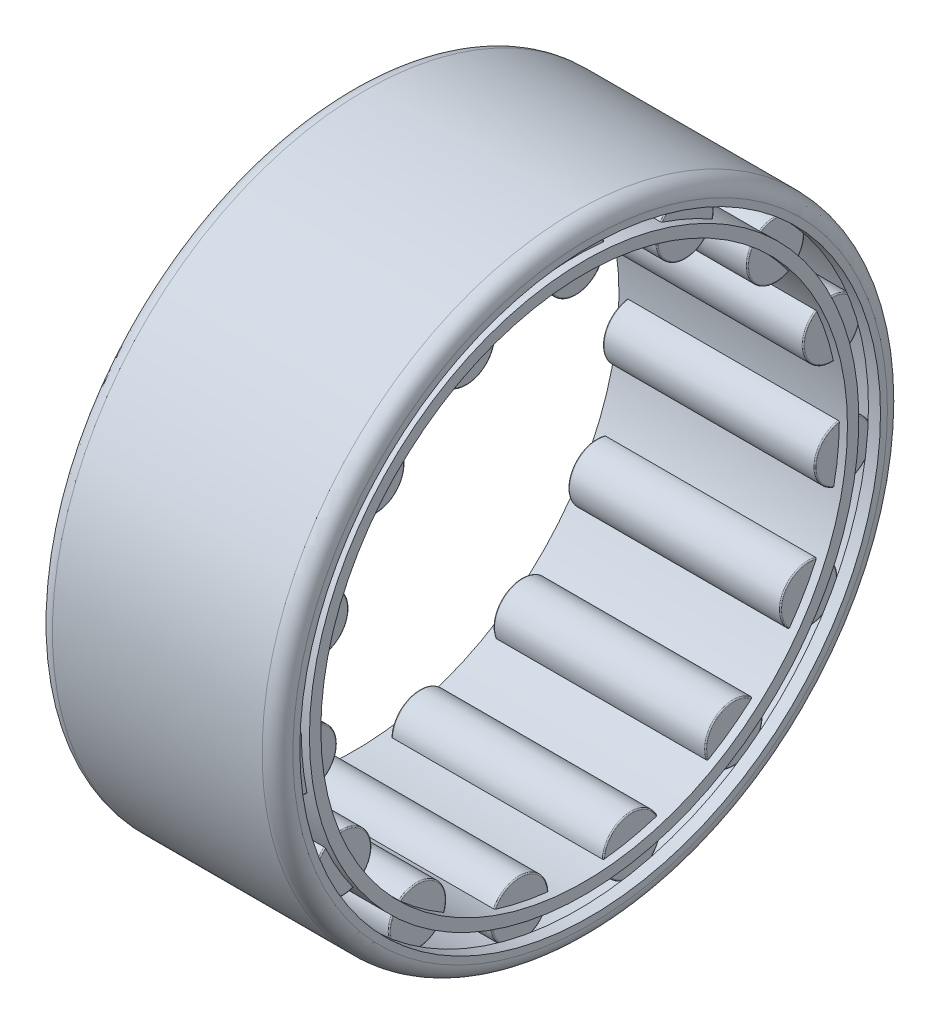
from build123d import *

# Parameters (mm, degrees)
CAGSPISKE_W           = 30.1625
CAGSPISKE_H           = 1.50642
ROLLERSDETAILED_COUNT = 15
ROLLERSDETAILED_ANGLE = 336


with BuildPart() as part:
    # InnRacSke → Race (revolve)
    with BuildSketch(Plane.XY):
        with BuildLine():
            Line((-14.2875, 38.3286), (-15.875, 38.3286))
            Line((-15.875, 38.3286), (-15.875, 39.243))
            ThreePointArc((-15.875, 39.243), (-15.279840979, 40.679840979), (-13.843, 41.275))
            Line((-13.843, 41.275), (13.843, 41.275))
            ThreePointArc((13.843, 41.275), (15.279840979, 40.679840979), (15.875, 39.243))
            Line((15.875, 39.243), (15.875, 38.3286))
            Line((15.875, 38.3286), (14.2875, 38.3286))
            Line((14.2875, 38.3286), (14.2875, 39.2811))
            Line((14.2875, 39.2811), (-14.2875, 39.2811))
            Line((-14.2875, 39.2811), (-14.2875, 38.3286))
        make_face()
    revolve(axis=Axis((-31.75, 0, 0), (1, 0, 0)))

    # RolDetSke → RollerDetailed (revolve)
    with BuildSketch(Plane.XY):
        with BuildLine():
            Line((-14.00175, 39.130958), (-14.00175, 35.51555))
            Line((-14.00175, 35.51555), (14.00175, 35.51555))
            Line((14.00175, 35.51555), (14.00175, 39.130958))
            ThreePointArc((14.00175, 39.130958), (13.95762798, 39.23747798), (13.851108, 39.2816))
            Line((13.851108, 39.2816), (-13.851108, 39.2816))
            ThreePointArc((-13.851108, 39.2816), (-13.95762798, 39.23747798), (-14.00175, 39.130958))
        make_face()
    rollerdetailed = revolve(axis=Axis((-28.575, 35.51555, 0), (1, 0, 0)))

    # CagSpiSke → CageSpine (revolve)
    with BuildSketch(Plane.XY):
        with Locations((0, 35.51555)):
            Rectangle(CAGSPISKE_W, CAGSPISKE_H)
    revolve(axis=Axis((-31.75, 0, 0), (1, 0, 0)))

    # RollersDetailed: RollerDetailed ×15 about axis
    rollersdetailed_axis = Axis((-50, 0, 0), (1, 0, 0))
    for i in range(1, ROLLERSDETAILED_COUNT):
        add(rollerdetailed.rotate(rollersdetailed_axis, i * ROLLERSDETAILED_ANGLE / (ROLLERSDETAILED_COUNT - 1)))


solid = part.part
